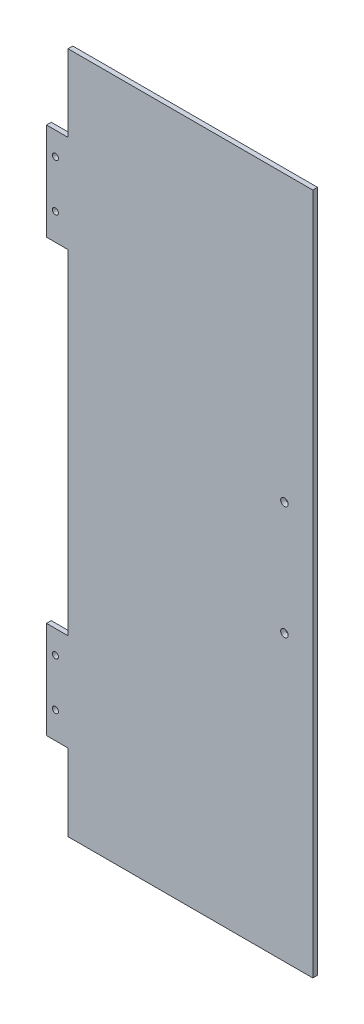
from build123d import *

# Parameters (mm, degrees)
BOSS_EXTRUDE3_DEPTH = 3.175
SKETCH2_R           = 2.032
CUT_EXTRUDE1_DEPTH  = 492.881230722
SKETCH4_R           = 2.54
CUT_EXTRUDE3_DEPTH  = 492.881230722


with BuildPart() as part:
    # Sketch1 → Boss-Extrude3 (new body)
    with BuildSketch(Plane.XY):
        Polygon((-164.338, 0), (0, 0), (0, 458.216), (-164.338, 458.216), (-164.338, 406.654), (-178.816, 406.654), (-178.816, 341.376), (-164.338, 341.376), (-164.338, 116.84), (-178.816, 116.84), (-178.816, 51.562), (-164.338, 51.562), align=None)
    extrude(amount=BOSS_EXTRUDE3_DEPTH)

    # Sketch2 → Cut-Extrude1 (cut, through all)
    with BuildSketch(Plane.XY.offset(3.175)):
        with Locations((-172.814936246, 69.493794716)):
            Circle(SKETCH2_R)
        with Locations((-172.814936246, 101.243794716)):
            Circle(SKETCH2_R)
        with Locations((-172.814936246, 391.16)):
            Circle(SKETCH2_R)
        with Locations((-172.814936246, 359.41)):
            Circle(SKETCH2_R)
    extrude(amount=-CUT_EXTRUDE1_DEPTH, mode=Mode.SUBTRACT)

    # Sketch4 → Cut-Extrude3 (cut, through all)
    with BuildSketch(Plane.XY.offset(3.175)):
        with Locations((-19.05, 190.985815808)):
            Circle(SKETCH4_R)
        with Locations((-19.05, 267.185815808)):
            Circle(SKETCH4_R)
    extrude(amount=-CUT_EXTRUDE3_DEPTH, mode=Mode.SUBTRACT)


solid = part.part
